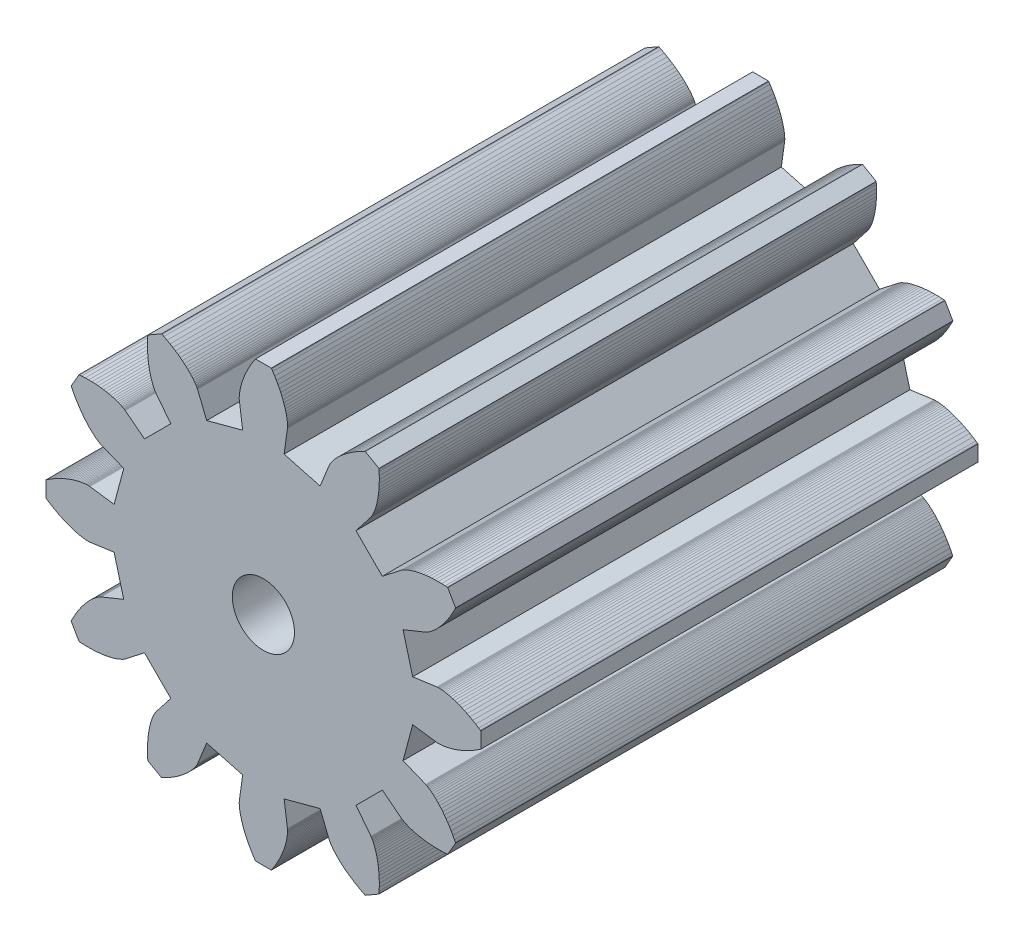
from build123d import *

# Parameters (mm, degrees)
SKETCH1_R              = 20
BOSS_EXTRUDE1_DEPTH    = 40
CUT_EXTRUDE1_START     = -40
CUT_EXTRUDE1_OUTLINE_R = 20
CUT_EXTRUDE1_DEPTH     = 40
SKETCH3_R              = 2.5
CUT_EXTRUDE2_DEPTH     = 40


# Read off the part's stored shape, not the designer's step: Cut-Extrude1
with BuildPart() as part:
    # Sketch1 → Boss-Extrude1 (new body)
    with BuildSketch(Plane(origin=(0, 0, 0), x_dir=(0, 1, 0), z_dir=(0, 0, 1))):
        with Locations(Location((0, 0, 0), (0, 0, 270))):
            Circle(SKETCH1_R)
    extrude(amount=BOSS_EXTRUDE1_DEPTH)

    # Cut-Extrude1 outline → Cut-Extrude1 (cut)
    with BuildSketch(Plane.XY.offset(40).offset(CUT_EXTRUDE1_START)):
        Circle(CUT_EXTRUDE1_OUTLINE_R)
        Polygon((12.009901102, -1.6667037), (11.234231302, -4.5615428), (13.061844602, -5.3036531), (13.073824102, -5.3090015), (13.096398902, -5.3198491), (13.129249902, -5.3368124), (13.172031702, -5.3604939), (13.224372302, -5.3914805), (13.285874402, -5.4303433), (13.356115602, -5.477636), (13.434649202, -5.5338942), (13.521004802, -5.5996344), (13.614689302, -5.6753531), (13.715187602, -5.7615258), (13.821963002, -5.8586065), (13.934458702, -5.9670264), (14.052098202, -6.0871934), (14.174286102, -6.2194912), (14.300409702, -6.3642787), (14.429839102, -6.5218891), (14.561928702, -6.6926294), (14.696018002, -6.8767798), (14.831433002, -7.0745928), (14.967486502, -7.2862931), (15.103479902, -7.5120768), (15.238703802, -7.7521107), (15.372439502, -8.0065323), (15.438522202, -8.1391733), (15.454945702, -8.1729012), (15.463141802, -8.1898504), (15.464165602, -8.191973), (15.464031402, -8.1922971), (14.8267531, -9.296095499), (14.8265395, -9.296373799), (14.8054129, -9.297924999), (14.767992, -9.300565799), (14.6200801, -9.309656899), (14.3328767, -9.321049299), (14.0573892, -9.323958899), (13.7938582, -9.319076999), (13.5424936, -9.307101299), (13.303475, -9.288735099), (13.0769514, -9.264685399), (12.8630412, -9.235662699), (12.6618319, -9.202378699), (12.4733805, -9.165546299), (12.2977132, -9.125877299), (12.1348258, -9.084081999), (11.9846836, -9.040867899), (11.8472215, -8.996937899), (11.7223446, -8.952990299), (11.609928, -8.909716399), (11.5098175, -8.867800299), (11.4218298, -8.827917399), (11.3457525, -8.790733099), (11.2813453, -8.756902099), (11.2283397, -8.727067099), (11.1864401, -8.701857699), (11.1553239, -8.681889599), (11.1346422, -8.667763099), (11.1240206, -8.660062699), (9.5675276, -7.448358299), (7.4483583, -9.567527599), (8.6600627, -11.124020599), (8.6677631, -11.134642199), (8.6818896, -11.155323899), (8.7018577, -11.186440099), (8.7270671, -11.228339699), (8.7569021, -11.281345299), (8.7907331, -11.345752499), (8.8279174, -11.421829799), (8.8678003, -11.509817499), (8.9097164, -11.609927999), (8.9529903, -11.722344599), (8.9969379, -11.847221499), (9.0408679, -11.984683599), (9.084082, -12.134825799), (9.1258773, -12.297713199), (9.1655463, -12.473380499), (9.2023787, -12.661831899), (9.2356627, -12.863041199), (9.2646854, -13.076951399), (9.2887351, -13.303474999), (9.3071013, -13.542493599), (9.319077, -13.793858199), (9.3239589, -14.057389199), (9.3210493, -14.332876699), (9.3096569, -14.620080099), (9.3005658, -14.767991999), (9.297925, -14.805412899), (9.2965485, -14.824189399), (9.2963738, -14.826539499), (9.2960955, -14.826753099), (8.192297101, -15.464031401), (8.191973001, -15.464165601), (8.172901201, -15.454945701), (8.139173301, -15.438522201), (8.006532301, -15.372439501), (7.752110701, -15.238703801), (7.512076801, -15.103479901), (7.286293101, -14.967486501), (7.074592801, -14.831433001), (6.876779801, -14.696018001), (6.692629401, -14.561928701), (6.521889101, -14.429839101), (6.364278701, -14.300409701), (6.219491201, -14.174286101), (6.087193401, -14.052098201), (5.967026401, -13.934458701), (5.858606501, -13.821963001), (5.761525801, -13.715187601), (5.675353101, -13.614689301), (5.599634401, -13.521004801), (5.533894201, -13.434649201), (5.477636001, -13.356115601), (5.430343301, -13.285874401), (5.391480501, -13.224372301), (5.360493901, -13.172031701), (5.336812401, -13.129249901), (5.319849101, -13.096398901), (5.309001501, -13.073824101), (5.303653101, -13.061844601), (4.561542801, -11.234231301), (1.666703701, -12.009901101), (1.937824001, -13.963715801), (1.939181901, -13.976764601), (1.941075001, -14.001738601), (1.942809801, -14.038670201), (1.943692001, -14.087561001), (1.943027101, -14.148382601), (1.940121901, -14.221076401), (1.934285901, -14.305553401), (1.924831601, -14.401694601), (1.911076701, -14.509350801), (1.892344701, -14.628343401), (1.867966101, -14.758463801), (1.837279401, -14.899474401), (1.799632901, -15.051108501), (1.754385001, -15.213070701), (1.700905701, -15.385037501), (1.638577801, -15.566657401), (1.566797901, -15.757551701), (1.484977201, -15.957314801), (1.392543001, -16.165514801), (1.288939401, -16.381694201), (1.173628301, -16.605370101), (1.046090601, -16.836035601), (0.905827101, -17.073159901), (0.752359401, -17.316189201), (0.670530201, -17.439739101), (0.649532801, -17.470826201), (0.638952501, -17.486398801), (0.637626101, -17.488346801), (0.637278301, -17.488392601), (-0.637278299, -17.488392601), (-0.637626099, -17.488346801), (-0.649532799, -17.470826201), (-0.670530199, -17.439739101), (-0.752359399, -17.316189201), (-0.905827099, -17.073159901), (-1.046090599, -16.836035601), (-1.173628299, -16.605370101), (-1.288939399, -16.381694201), (-1.392542999, -16.165514801), (-1.484977199, -15.957314801), (-1.566797899, -15.757551701), (-1.638577799, -15.566657401), (-1.700905699, -15.385037501), (-1.754384999, -15.213070701), (-1.799632899, -15.051108501), (-1.837279399, -14.899474401), (-1.867966099, -14.758463801), (-1.892344699, -14.628343401), (-1.911076699, -14.509350801), (-1.924831599, -14.401694601), (-1.934285899, -14.305553401), (-1.940121899, -14.221076401), (-1.943027099, -14.148382601), (-1.943691999, -14.087561001), (-1.942809799, -14.038670201), (-1.941074999, -14.001738601), (-1.939181899, -13.976764601), (-1.937823999, -13.963715801), (-1.666703699, -12.009901101), (-4.561542799, -11.234231301), (-5.303653099, -13.061844601), (-5.309001499, -13.073824101), (-5.319849099, -13.096398901), (-5.336812399, -13.129249901), (-5.360493899, -13.172031701), (-5.391480499, -13.224372301), (-5.430343299, -13.285874401), (-5.477635999, -13.356115601), (-5.533894199, -13.434649201), (-5.599634399, -13.521004801), (-5.675353099, -13.614689301), (-5.761525799, -13.715187601), (-5.858606499, -13.821963001), (-5.967026399, -13.934458701), (-6.087193399, -14.052098201), (-6.219491199, -14.174286101), (-6.364278699, -14.300409701), (-6.521889099, -14.429839101), (-6.692629399, -14.561928701), (-6.876779799, -14.696018001), (-7.074592799, -14.831433001), (-7.286293099, -14.967486501), (-7.512076799, -15.103479901), (-7.752110699, -15.238703801), (-8.006532299, -15.372439501), (-8.139173299, -15.438522201), (-8.172901199, -15.454945701), (-8.189850399, -15.463141801), (-8.191972999, -15.464165601), (-8.192297099, -15.464031401), (-9.296095497, -14.826753099), (-9.296373797, -14.826539499), (-9.297924997, -14.805412899), (-9.300565797, -14.767991999), (-9.309656897, -14.620080099), (-9.321049297, -14.332876699), (-9.323958897, -14.057389199), (-9.319076997, -13.793858199), (-9.307101297, -13.542493599), (-9.288735097, -13.303474999), (-9.264685397, -13.076951399), (-9.235662697, -12.863041199), (-9.202378697, -12.661831899), (-9.165546297, -12.473380499), (-9.125877297, -12.297713199), (-9.084081997, -12.134825799), (-9.040867897, -11.984683599), (-8.996937897, -11.847221499), (-8.952990297, -11.722344599), (-8.909716397, -11.609927999), (-8.867800297, -11.509817499), (-8.827917397, -11.421829799), (-8.790733097, -11.345752499), (-8.756902097, -11.281345299), (-8.727067097, -11.228339699), (-8.701857697, -11.186440099), (-8.681889597, -11.155323899), (-8.667763097, -11.134642199), (-8.660062697, -11.124020599), (-7.448358297, -9.567527599), (-9.567527597, -7.448358299), (-11.124020597, -8.660062699), (-11.134642197, -8.667763099), (-11.155323897, -8.681889599), (-11.186440097, -8.701857699), (-11.228339697, -8.727067099), (-11.281345297, -8.756902099), (-11.345752497, -8.790733099), (-11.421829797, -8.827917399), (-11.509817497, -8.867800299), (-11.609927997, -8.909716399), (-11.722344597, -8.952990299), (-11.847221497, -8.996937899), (-11.984683597, -9.040867899), (-12.134825797, -9.084081999), (-12.297713197, -9.125877299), (-12.473380497, -9.165546299), (-12.661831897, -9.202378699), (-12.863041197, -9.235662699), (-13.076951397, -9.264685399), (-13.303474997, -9.288735099), (-13.542493597, -9.307101299), (-13.793858197, -9.319076999), (-14.057389197, -9.323958899), (-14.332876697, -9.321049299), (-14.620080097, -9.309656899), (-14.767991997, -9.300565799), (-14.805412897, -9.297924999), (-14.824189397, -9.296548499), (-14.826539497, -9.296373799), (-14.826753097, -9.296095499), (-15.4640314, -8.1922971), (-15.4641656, -8.191973), (-15.4549457, -8.1729012), (-15.4385222, -8.1391733), (-15.3724395, -8.0065323), (-15.2387038, -7.7521107), (-15.1034799, -7.5120768), (-14.9674865, -7.2862931), (-14.831433, -7.0745928), (-14.696018, -6.8767798), (-14.5619287, -6.6926294), (-14.4298391, -6.5218891), (-14.3004097, -6.3642787), (-14.1742861, -6.2194912), (-14.0520982, -6.0871934), (-13.9344587, -5.9670264), (-13.821963, -5.8586065), (-13.7151876, -5.7615258), (-13.6146893, -5.6753531), (-13.5210048, -5.5996344), (-13.4346492, -5.5338942), (-13.3561156, -5.477636), (-13.2858744, -5.4303433), (-13.2243723, -5.3914805), (-13.1720317, -5.3604939), (-13.1292499, -5.3368124), (-13.0963989, -5.3198491), (-13.0738241, -5.3090015), (-13.0618446, -5.3036531), (-11.2342313, -4.5615428), (-12.0099011, -1.6667037), (-13.9637158, -1.937824), (-13.9767646, -1.9391819), (-14.0017386, -1.941075), (-14.0386702, -1.9428098), (-14.087561, -1.943692), (-14.1483826, -1.9430271), (-14.2210764, -1.9401219), (-14.3055534, -1.9342859), (-14.4016946, -1.9248316), (-14.5093508, -1.9110767), (-14.6283434, -1.8923447), (-14.7584638, -1.8679661), (-14.8994744, -1.8372794), (-15.0511085, -1.7996329), (-15.2130707, -1.754385), (-15.3850375, -1.7009057), (-15.5666574, -1.6385778), (-15.7575517, -1.5667979), (-15.9573148, -1.4849772), (-16.1655148, -1.392543), (-16.3816942, -1.2889394), (-16.6053701, -1.1736283), (-16.8360356, -1.0460906), (-17.0731599, -0.9058271), (-17.3161892, -0.7523594), (-17.4397391, -0.6705302), (-17.4708262, -0.6495328), (-17.4863988, -0.6389525), (-17.4883468, -0.6376261), (-17.4883926, -0.6372783), (-17.4883926, 0.6372783), (-17.4883468, 0.6376261), (-17.4708262, 0.6495328), (-17.4397391, 0.6705302), (-17.3161892, 0.7523594), (-17.0731599, 0.9058271), (-16.8360356, 1.0460906), (-16.6053701, 1.1736283), (-16.3816942, 1.2889394), (-16.1655148, 1.392543), (-15.9573148, 1.4849772), (-15.7575517, 1.5667979), (-15.5666574, 1.6385778), (-15.3850375, 1.7009057), (-15.2130707, 1.754385), (-15.0511085, 1.7996329), (-14.8994744, 1.8372794), (-14.7584638, 1.8679661), (-14.6283434, 1.8923447), (-14.5093508, 1.9110767), (-14.4016946, 1.9248316), (-14.3055534, 1.9342859), (-14.2210764, 1.9401219), (-14.1483826, 1.9430271), (-14.087561, 1.943692), (-14.0386702, 1.9428098), (-14.0017386, 1.941075), (-13.9767646, 1.9391819), (-13.9637158, 1.937824), (-12.0099011, 1.6667037), (-11.2342313, 4.5615428), (-13.0618446, 5.3036531), (-13.0738241, 5.3090015), (-13.0963989, 5.3198491), (-13.1292499, 5.3368124), (-13.1720317, 5.3604939), (-13.2243723, 5.3914805), (-13.2858744, 5.4303433), (-13.3561156, 5.477636), (-13.4346492, 5.5338942), (-13.5210048, 5.5996344), (-13.6146893, 5.6753531), (-13.7151876, 5.7615258), (-13.821963, 5.8586065), (-13.9344587, 5.9670264), (-14.0520982, 6.0871934), (-14.1742861, 6.2194912), (-14.3004097, 6.3642787), (-14.4298391, 6.5218891), (-14.5619287, 6.6926294), (-14.696018, 6.8767798), (-14.831433, 7.0745928), (-14.9674865, 7.2862931), (-15.1034799, 7.5120768), (-15.2387038, 7.7521107), (-15.3724395, 8.0065323), (-15.4385222, 8.1391733), (-15.4549457, 8.1729012), (-15.4631418, 8.1898504), (-15.4641656, 8.191973), (-15.4640314, 8.1922971), (-14.826753097, 9.296095499), (-14.826539497, 9.296373799), (-14.805412897, 9.297924999), (-14.767991997, 9.300565799), (-14.620080097, 9.309656899), (-14.332876697, 9.321049299), (-14.057389197, 9.323958899), (-13.793858197, 9.319076999), (-13.542493597, 9.307101299), (-13.303474997, 9.288735099), (-13.076951397, 9.264685399), (-12.863041197, 9.235662699), (-12.661831897, 9.202378699), (-12.473380497, 9.165546299), (-12.297713197, 9.125877299), (-12.134825797, 9.084081999), (-11.984683597, 9.040867899), (-11.847221497, 8.996937899), (-11.722344597, 8.952990299), (-11.609927997, 8.909716399), (-11.509817497, 8.867800299), (-11.421829797, 8.827917399), (-11.345752497, 8.790733099), (-11.281345297, 8.756902099), (-11.228339697, 8.727067099), (-11.186440097, 8.701857699), (-11.155323897, 8.681889599), (-11.134642197, 8.667763099), (-11.124020597, 8.660062699), (-9.567527597, 7.448358299), (-7.448358297, 9.567527599), (-8.660062697, 11.124020599), (-8.667763097, 11.134642199), (-8.681889597, 11.155323899), (-8.701857697, 11.186440099), (-8.727067097, 11.228339699), (-8.756902097, 11.281345299), (-8.790733097, 11.345752499), (-8.827917397, 11.421829799), (-8.867800297, 11.509817499), (-8.909716397, 11.609927999), (-8.952990297, 11.722344599), (-8.996937897, 11.847221499), (-9.040867897, 11.984683599), (-9.084081997, 12.134825799), (-9.125877297, 12.297713199), (-9.165546297, 12.473380499), (-9.202378697, 12.661831899), (-9.235662697, 12.863041199), (-9.264685397, 13.076951399), (-9.288735097, 13.303474999), (-9.307101297, 13.542493599), (-9.319076997, 13.793858199), (-9.323958897, 14.057389199), (-9.321049297, 14.332876699), (-9.309656897, 14.620080099), (-9.300565797, 14.767991999), (-9.297924997, 14.805412899), (-9.296548497, 14.824189399), (-9.296373797, 14.826539499), (-9.296095497, 14.826753099), (-8.192297099, 15.464031401), (-8.191972999, 15.464165601), (-8.172901199, 15.454945701), (-8.139173299, 15.438522201), (-8.006532299, 15.372439501), (-7.752110699, 15.238703801), (-7.512076799, 15.103479901), (-7.286293099, 14.967486501), (-7.074592799, 14.831433001), (-6.876779799, 14.696018001), (-6.692629399, 14.561928701), (-6.521889099, 14.429839101), (-6.364278699, 14.300409701), (-6.219491199, 14.174286101), (-6.087193399, 14.052098201), (-5.967026399, 13.934458701), (-5.858606499, 13.821963001), (-5.761525799, 13.715187601), (-5.675353099, 13.614689301), (-5.599634399, 13.521004801), (-5.533894199, 13.434649201), (-5.477635999, 13.356115601), (-5.430343299, 13.285874401), (-5.391480499, 13.224372301), (-5.360493899, 13.172031701), (-5.336812399, 13.129249901), (-5.319849099, 13.096398901), (-5.309001499, 13.073824101), (-5.303653099, 13.061844601), (-4.561542799, 11.234231301), (-1.666703699, 12.009901101), (-1.937823999, 13.963715801), (-1.939181899, 13.976764601), (-1.941074999, 14.001738601), (-1.942809799, 14.038670201), (-1.943691999, 14.087561001), (-1.943027099, 14.148382601), (-1.940121899, 14.221076401), (-1.934285899, 14.305553401), (-1.924831599, 14.401694601), (-1.911076699, 14.509350801), (-1.892344699, 14.628343401), (-1.867966099, 14.758463801), (-1.837279399, 14.899474401), (-1.799632899, 15.051108501), (-1.754384999, 15.213070701), (-1.700905699, 15.385037501), (-1.638577799, 15.566657401), (-1.566797899, 15.757551701), (-1.484977199, 15.957314801), (-1.392542999, 16.165514801), (-1.288939399, 16.381694201), (-1.173628299, 16.605370101), (-1.046090599, 16.836035601), (-0.905827099, 17.073159901), (-0.752359399, 17.316189201), (-0.670530199, 17.439739101), (-0.649532799, 17.470826201), (-0.638952499, 17.486398801), (-0.637626099, 17.488346801), (-0.637278299, 17.488392601), (0.637278301, 17.488392601), (0.637626101, 17.488346801), (0.649532801, 17.470826201), (0.670530201, 17.439739101), (0.752359401, 17.316189201), (0.905827101, 17.073159901), (1.046090601, 16.836035601), (1.173628301, 16.605370101), (1.288939401, 16.381694201), (1.392543001, 16.165514801), (1.484977201, 15.957314801), (1.566797901, 15.757551701), (1.638577801, 15.566657401), (1.700905701, 15.385037501), (1.754385001, 15.213070701), (1.799632901, 15.051108501), (1.837279401, 14.899474401), (1.867966101, 14.758463801), (1.892344701, 14.628343401), (1.911076701, 14.509350801), (1.924831601, 14.401694601), (1.934285901, 14.305553401), (1.940121901, 14.221076401), (1.943027101, 14.148382601), (1.943692001, 14.087561001), (1.942809801, 14.038670201), (1.941075001, 14.001738601), (1.939181901, 13.976764601), (1.937824001, 13.963715801), (1.666703701, 12.009901101), (4.561542801, 11.234231301), (5.303653101, 13.061844601), (5.309001501, 13.073824101), (5.319849101, 13.096398901), (5.336812401, 13.129249901), (5.360493901, 13.172031701), (5.391480501, 13.224372301), (5.430343301, 13.285874401), (5.477636001, 13.356115601), (5.533894201, 13.434649201), (5.599634401, 13.521004801), (5.675353101, 13.614689301), (5.761525801, 13.715187601), (5.858606501, 13.821963001), (5.967026401, 13.934458701), (6.087193401, 14.052098201), (6.219491201, 14.174286101), (6.364278701, 14.300409701), (6.521889101, 14.429839101), (6.692629401, 14.561928701), (6.876779801, 14.696018001), (7.074592801, 14.831433001), (7.286293101, 14.967486501), (7.512076801, 15.103479901), (7.752110701, 15.238703801), (8.006532301, 15.372439501), (8.139173301, 15.438522201), (8.172901201, 15.454945701), (8.189850401, 15.463141801), (8.191973001, 15.464165601), (8.192297101, 15.464031401), (9.2960955, 14.826753099), (9.2963738, 14.826539499), (9.297925, 14.805412899), (9.3005658, 14.767991999), (9.3096569, 14.620080099), (9.3210493, 14.332876699), (9.3239589, 14.057389199), (9.319077, 13.793858199), (9.3071013, 13.542493599), (9.2887351, 13.303474999), (9.2646854, 13.076951399), (9.2356627, 12.863041199), (9.2023787, 12.661831899), (9.1655463, 12.473380499), (9.1258773, 12.297713199), (9.084082, 12.134825799), (9.0408679, 11.984683599), (8.9969379, 11.847221499), (8.9529903, 11.722344599), (8.9097164, 11.609927999), (8.8678003, 11.509817499), (8.8279174, 11.421829799), (8.7907331, 11.345752499), (8.7569021, 11.281345299), (8.7270671, 11.228339699), (8.7018577, 11.186440099), (8.6818896, 11.155323899), (8.6677631, 11.134642199), (8.6600627, 11.124020599), (7.4483583, 9.567527599), (9.5675276, 7.448358299), (11.1240206, 8.660062699), (11.1346422, 8.667763099), (11.1553239, 8.681889599), (11.1864401, 8.701857699), (11.2283397, 8.727067099), (11.2813453, 8.756902099), (11.3457525, 8.790733099), (11.4218298, 8.827917399), (11.5098175, 8.867800299), (11.609928, 8.909716399), (11.7223446, 8.952990299), (11.8472215, 8.996937899), (11.9846836, 9.040867899), (12.1348258, 9.084081999), (12.2977132, 9.125877299), (12.4733805, 9.165546299), (12.6618319, 9.202378699), (12.8630412, 9.235662699), (13.0769514, 9.264685399), (13.303475, 9.288735099), (13.5424936, 9.307101299), (13.7938582, 9.319076999), (14.0573892, 9.323958899), (14.3328767, 9.321049299), (14.6200801, 9.309656899), (14.767992, 9.300565799), (14.8054129, 9.297924999), (14.8241894, 9.296548499), (14.8265395, 9.296373799), (14.8267531, 9.296095499), (15.464031402, 8.1922971), (15.464165602, 8.191973), (15.454945702, 8.1729012), (15.438522202, 8.1391733), (15.372439502, 8.0065323), (15.238703802, 7.7521107), (15.103479902, 7.5120768), (14.967486502, 7.2862931), (14.831433002, 7.0745928), (14.696018002, 6.8767798), (14.561928702, 6.6926294), (14.429839102, 6.5218891), (14.300409702, 6.3642787), (14.174286102, 6.2194912), (14.052098202, 6.0871934), (13.934458702, 5.9670264), (13.821963002, 5.8586065), (13.715187602, 5.7615258), (13.614689302, 5.6753531), (13.521004802, 5.5996344), (13.434649202, 5.5338942), (13.356115602, 5.477636), (13.285874402, 5.4303433), (13.224372302, 5.3914805), (13.172031702, 5.3604939), (13.129249902, 5.3368124), (13.096398902, 5.3198491), (13.073824102, 5.3090015), (13.061844602, 5.3036531), (11.234231302, 4.5615428), (12.009901102, 1.6667037), (13.963715802, 1.937824), (13.976764602, 1.9391819), (14.001738602, 1.941075), (14.038670202, 1.9428098), (14.087561002, 1.943692), (14.148382602, 1.9430271), (14.221076402, 1.9401219), (14.305553402, 1.9342859), (14.401694602, 1.9248316), (14.509350802, 1.9110767), (14.628343402, 1.8923447), (14.758463802, 1.8679661), (14.899474402, 1.8372794), (15.051108502, 1.7996329), (15.213070702, 1.754385), (15.385037502, 1.7009057), (15.566657402, 1.6385778), (15.757551702, 1.5667979), (15.957314802, 1.4849772), (16.165514802, 1.392543), (16.381694202, 1.2889394), (16.605370102, 1.1736283), (16.836035602, 1.0460906), (17.073159902, 0.9058271), (17.316189202, 0.7523594), (17.439739102, 0.6705302), (17.470826202, 0.6495328), (17.486398802, 0.6389525), (17.488346802, 0.6376261), (17.488392602, 0.6372783), (17.488392602, -0.6372783), (17.488346802, -0.6376261), (17.470826202, -0.6495328), (17.439739102, -0.6705302), (17.316189202, -0.7523594), (17.073159902, -0.9058271), (16.836035602, -1.0460906), (16.605370102, -1.1736283), (16.381694202, -1.2889394), (16.165514802, -1.392543), (15.957314802, -1.4849772), (15.757551702, -1.5667979), (15.566657402, -1.6385778), (15.385037502, -1.7009057), (15.213070702, -1.754385), (15.051108502, -1.7996329), (14.899474402, -1.8372794), (14.758463802, -1.8679661), (14.628343402, -1.8923447), (14.509350802, -1.9110767), (14.401694602, -1.9248316), (14.305553402, -1.9342859), (14.221076402, -1.9401219), (14.148382602, -1.9430271), (14.087561002, -1.943692), (14.038670202, -1.9428098), (14.001738602, -1.941075), (13.976764602, -1.9391819), (13.963715802, -1.937824), align=None, mode=Mode.SUBTRACT)
    extrude(amount=CUT_EXTRUDE1_DEPTH, mode=Mode.SUBTRACT)

    # Sketch3 → Cut-Extrude2 (cut)
    with BuildSketch(Plane.XY.offset(40)):
        Circle(SKETCH3_R)
    extrude(amount=-CUT_EXTRUDE2_DEPTH, mode=Mode.SUBTRACT)


solid = part.part
